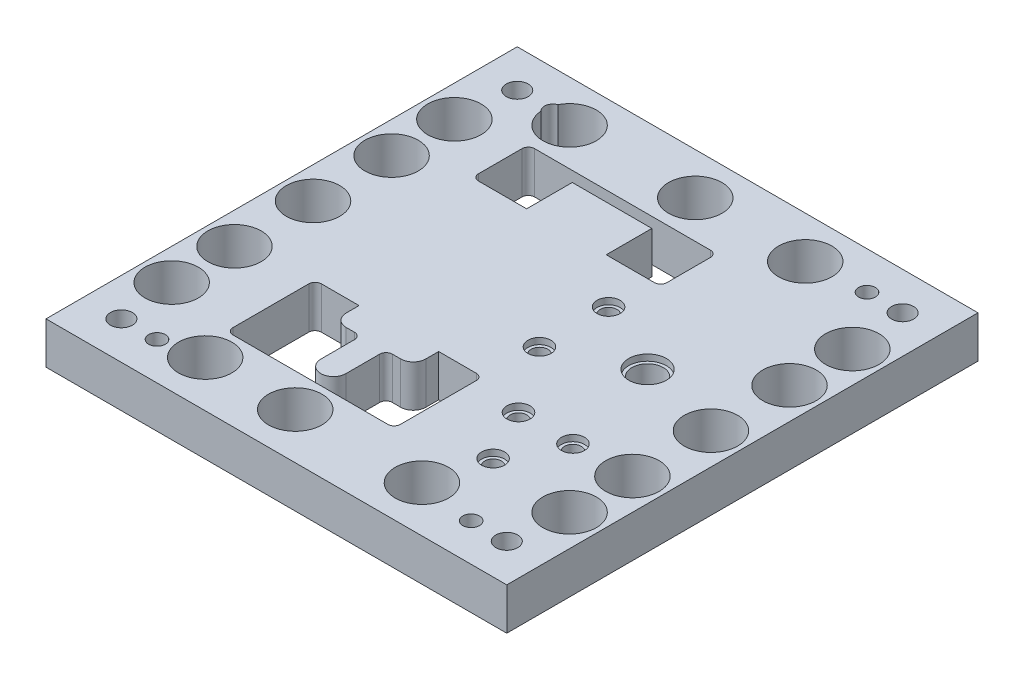
from build123d import *

# Parameters (mm, degrees)
SKETCH1_W                                    = 220
SKETCH1_H                                    = 225
BOSS_EXTRUDE1_DEPTH                          = 20
CUT_EXTRUDE3_REACH                           = 160.607
CUT_EXTRUDE4_REACH                           = 160.607
CUT_EXTRUDE5_REACH                           = 160.607
SKETCH7_R                                    = 4
CUT_EXTRUDE6_REACH                           = 160.607
SKETCH9_R                                    = 7.5
SKETCH10_R                                   = 5.5
CUT_EXTRUDE7_DEPTH                           = 3
SKETCH11_R                                   = 9
CUT_EXTRUDE8_DEPTH                           = 3
CBORE_FOR_M10_HEX_SOCKET_HEAD_CAP_SC_2_COUNT = 2
CBORE_FOR_M10_HEX_SOCKET_HEAD_CAP_SC_2_PITCH = 184
CBORE_FOR_M10_HEX_SOCKET_HEAD_CAP_SC_3_COUNT = 2
CBORE_FOR_M10_HEX_SOCKET_HEAD_CAP_SC_3_PITCH = 263.774524926
CBORE_FOR_M10_HEX_SOCKET_HEAD_CAP_SC_4_COUNT = 2
CBORE_FOR_M10_HEX_SOCKET_HEAD_CAP_SC_4_PITCH = 189
F_8_0MM_DOWEL_HOLE1_D                        = 8
F_25_5_25_5_DIAMETER_HOLE1_D                 = 25.5


with BuildPart() as part:
    # Sketch1 → Boss-Extrude1 (new body)
    with BuildSketch(Plane(origin=(0, 0, 0), x_dir=(1, 0, 0), z_dir=(0, 1, 0))):
        Rectangle(SKETCH1_W, SKETCH1_H)
    extrude(amount=-BOSS_EXTRUDE1_DEPTH)

    # Sketch5 → Cut-Extrude3 (cut, up to next)
    with BuildSketch(Plane(origin=(0, 0, 0), x_dir=(1, 0, 0), z_dir=(0, 1, 0)), mode=Mode.PRIVATE) as cut_extrude3_sk1:
        with BuildLine():
            Line((-2.75, -38.4), (-2.75, -32.27))
            Line((-2.75, -32.27), (15.25, -32.27))
            ThreePointArc((15.25, -32.27), (17.371320344, -33.148679656), (18.25, -35.27))
            Line((18.25, -35.27), (18.25, -71.53))
            ThreePointArc((18.25, -71.53), (17.371320344, -73.651320344), (15.25, -74.53))
            Line((15.25, -74.53), (-58.75, -74.53))
            ThreePointArc((-58.75, -74.53), (-60.871320344, -73.651320344), (-61.75, -71.53))
            Line((-61.75, -71.53), (-61.75, -35.27))
            ThreePointArc((-61.75, -35.27), (-60.871320344, -33.148679656), (-58.75, -32.27))
            Line((-58.75, -32.27), (-40.75, -32.27))
            Line((-40.75, -32.27), (-40.75, -38.4))
            ThreePointArc((-40.75, -38.4), (-38.992640687, -42.642640687), (-34.75, -44.4))
            Line((-34.75, -44.4), (-30.75, -44.4))
            ThreePointArc((-30.75, -44.4), (-28.628679656, -45.278679656), (-27.75, -47.4))
            Line((-27.75, -47.4), (-27.75, -63.53))
            ThreePointArc((-27.75, -63.53), (-21.75, -69.53), (-15.75, -63.53))
            Line((-15.75, -63.53), (-15.75, -47.4))
            ThreePointArc((-15.75, -47.4), (-14.871320344, -45.278679656), (-12.75, -44.4))
            Line((-12.75, -44.4), (-8.75, -44.4))
            ThreePointArc((-8.75, -44.4), (-4.507359313, -42.642640687), (-2.75, -38.4))
        make_face()
    cut_extrude3_tool1 = extrude(cut_extrude3_sk1.sketch, amount=-CUT_EXTRUDE3_REACH, mode=Mode.PRIVATE) & part.part
    add(cut_extrude3_tool1.solids().sort_by_distance((-1.84524, 0, 35.335))[0], mode=Mode.SUBTRACT)

    # Sketch6 → Cut-Extrude4 (cut, up to next)
    with BuildSketch(Plane(origin=(0, 0, 0), x_dir=(1, 0, 0), z_dir=(0, 1, 0)), mode=Mode.PRIVATE) as cut_extrude4_sk1:
        with BuildLine():
            Line((-40.75, 47.73), (-63.75, 47.73))
            ThreePointArc((-63.75, 47.73), (-65.871320344, 48.608679656), (-66.75, 50.73))
            Line((-66.75, 50.73), (-66.75, 71.53))
            ThreePointArc((-66.75, 71.53), (-65.871320344, 73.651320344), (-63.75, 74.53))
            Line((-63.75, 74.53), (20.25, 74.53))
            ThreePointArc((20.25, 74.53), (22.371320344, 73.651320344), (23.25, 71.53))
            Line((23.25, 71.53), (23.25, 50.73))
            ThreePointArc((23.25, 50.73), (22.371320344, 48.608679656), (20.25, 47.73))
            Line((20.25, 47.73), (-2.75, 47.73))
            Line((-2.75, 47.73), (-2.75, 69.53))
            Line((-2.75, 69.53), (-40.75, 69.53))
            Line((-40.75, 69.53), (-40.75, 47.73))
        make_face()
    cut_extrude4_tool1 = extrude(cut_extrude4_sk1.sketch, amount=-CUT_EXTRUDE4_REACH, mode=Mode.PRIVATE) & part.part
    add(cut_extrude4_tool1.solids().sort_by_distance((-52.25, 0, -48.669055))[0], mode=Mode.SUBTRACT)

    # Sketch7 → Cut-Extrude5 (cut, up to next)
    with BuildSketch(Plane(origin=(0, 0, 0), x_dir=(1, 0, 0), z_dir=(0, 1, 0)), mode=Mode.PRIVATE) as cut_extrude5_sk1:
        with Locations((54.5, -63.53)):
            Circle(SKETCH7_R)
    cut_extrude5_tool1 = extrude(cut_extrude5_sk1.sketch, amount=-CUT_EXTRUDE5_REACH, mode=Mode.PRIVATE) & part.part
    # Sketch7 → Cut-Extrude5 (cut, up to next)
    with BuildSketch(Plane(origin=(0, 0, 0), x_dir=(1, 0, 0), z_dir=(0, 1, 0)), mode=Mode.PRIVATE) as cut_extrude5_sk2:
        with Locations((67.5, -38.4)):
            Circle(SKETCH7_R)
    cut_extrude5_tool2 = extrude(cut_extrude5_sk2.sketch, amount=-CUT_EXTRUDE5_REACH, mode=Mode.PRIVATE) & part.part
    # Sketch7 → Cut-Extrude5 (cut, up to next)
    with BuildSketch(Plane(origin=(0, 0, 0), x_dir=(1, 0, 0), z_dir=(0, 1, 0)), mode=Mode.PRIVATE) as cut_extrude5_sk3:
        with Locations((41.5, -38.4)):
            Circle(SKETCH7_R)
    cut_extrude5_tool3 = extrude(cut_extrude5_sk3.sketch, amount=-CUT_EXTRUDE5_REACH, mode=Mode.PRIVATE) & part.part
    # Sketch7 → Cut-Extrude5 (cut, up to next)
    with BuildSketch(Plane(origin=(0, 0, 0), x_dir=(1, 0, 0), z_dir=(0, 1, 0)), mode=Mode.PRIVATE) as cut_extrude5_sk4:
        with Locations((19.38, -6.27)):
            Circle(SKETCH7_R)
    cut_extrude5_tool4 = extrude(cut_extrude5_sk4.sketch, amount=-CUT_EXTRUDE5_REACH, mode=Mode.PRIVATE) & part.part
    # Sketch7 → Cut-Extrude5 (cut, up to next)
    with BuildSketch(Plane(origin=(0, 0, 0), x_dir=(1, 0, 0), z_dir=(0, 1, 0)), mode=Mode.PRIVATE) as cut_extrude5_sk5:
        with Locations((19.38, 26.73)):
            Circle(SKETCH7_R)
    cut_extrude5_tool5 = extrude(cut_extrude5_sk5.sketch, amount=-CUT_EXTRUDE5_REACH, mode=Mode.PRIVATE) & part.part
    add(cut_extrude5_tool1.solids().sort_by_distance((54.5, 0, 63.53))[0], mode=Mode.SUBTRACT)
    add(cut_extrude5_tool2.solids().sort_by_distance((67.5, 0, 38.4))[0], mode=Mode.SUBTRACT)
    add(cut_extrude5_tool3.solids().sort_by_distance((41.5, 0, 38.4))[0], mode=Mode.SUBTRACT)
    add(cut_extrude5_tool4.solids().sort_by_distance((19.38, 0, 6.27))[0], mode=Mode.SUBTRACT)
    add(cut_extrude5_tool5.solids().sort_by_distance((19.38, 0, -26.73))[0], mode=Mode.SUBTRACT)

    # Sketch9 → Cut-Extrude6 (cut, up to next)
    with BuildSketch(Plane(origin=(0, 0, 0), x_dir=(1, 0, 0), z_dir=(0, 1, 0)), mode=Mode.PRIVATE) as cut_extrude6_sk1:
        with Locations((54.5, 10.23)):
            Circle(SKETCH9_R)
    cut_extrude6_tool1 = extrude(cut_extrude6_sk1.sketch, amount=-CUT_EXTRUDE6_REACH, mode=Mode.PRIVATE) & part.part
    add(cut_extrude6_tool1.solids().sort_by_distance((54.5, 0, -10.23))[0], mode=Mode.SUBTRACT)

    # Sketch10 → Cut-Extrude7 (cut)
    with BuildSketch(Plane(origin=(0, 0, 0), x_dir=(1, 0, 0), z_dir=(0, 1, 0))):
        with Locations((19.38, 26.73)):
            Circle(SKETCH10_R)
        with Locations((19.38, -6.27)):
            Circle(SKETCH10_R)
        with Locations((41.5, -38.4)):
            Circle(SKETCH10_R)
        with Locations((67.5, -38.4)):
            Circle(SKETCH10_R)
        with Locations((54.5, -63.53)):
            Circle(SKETCH10_R)
    extrude(amount=-CUT_EXTRUDE7_DEPTH, mode=Mode.SUBTRACT)

    # Sketch11 → Cut-Extrude8 (cut)
    with BuildSketch(Plane(origin=(0, 0, 0), x_dir=(1, 0, 0), z_dir=(0, 1, 0))):
        with Locations((54.5, 10.23)):
            Circle(SKETCH11_R)
    extrude(amount=-CUT_EXTRUDE8_DEPTH, mode=Mode.SUBTRACT)

    # Sketch16 → CBORE for M10 Hex Socket Head Cap Screw1 (revolve, cut)
    with BuildSketch(Plane(origin=(92, -20, -94.5), x_dir=(0, 0, -1), z_dir=(1, 0, 0))):
        Polygon((0, 0), (0, 20), (5.25, 20), (5.25, 10.6), (9, 10.6), (9, 0.025), (9.025, 0), align=None)
    cbore_for_m10_hex_socket_head_cap_screw1 = revolve(axis=Axis((92, -26.35, -94.5), (0, 1, 0)), mode=Mode.SUBTRACT)

    # CBORE for M10 Hex Socket Head Cap Sc 2: CBORE for M10 Hex Socket Head Cap Screw1 ×2
    with Locations(*[(-i * CBORE_FOR_M10_HEX_SOCKET_HEAD_CAP_SC_2_PITCH, 0, 0) for i in range(1, CBORE_FOR_M10_HEX_SOCKET_HEAD_CAP_SC_2_COUNT)]):
        add(cbore_for_m10_hex_socket_head_cap_screw1, mode=Mode.SUBTRACT)

    # CBORE for M10 Hex Socket Head Cap Sc 3: CBORE for M10 Hex Socket Head Cap Screw1 ×2
    with Locations(*[Vector(-0.6975654682783963, 0, 0.7165210516555266) * (i * CBORE_FOR_M10_HEX_SOCKET_HEAD_CAP_SC_3_PITCH) for i in range(1, CBORE_FOR_M10_HEX_SOCKET_HEAD_CAP_SC_3_COUNT)]):
        add(cbore_for_m10_hex_socket_head_cap_screw1, mode=Mode.SUBTRACT)

    # CBORE for M10 Hex Socket Head Cap Sc 4: CBORE for M10 Hex Socket Head Cap Screw1 ×2
    with Locations(*[(0, 0, i * CBORE_FOR_M10_HEX_SOCKET_HEAD_CAP_SC_4_PITCH) for i in range(1, CBORE_FOR_M10_HEX_SOCKET_HEAD_CAP_SC_4_COUNT)]):
        add(cbore_for_m10_hex_socket_head_cap_screw1, mode=Mode.SUBTRACT)

    # Ø8.0mm Dowel Hole1 (through all)
    with Locations(Plane(origin=(0, -20, 0), x_dir=(-1, 0, 0), z_dir=(0, -1, 0))):
        with Locations((-75, 94.5), (75, 94.5), (75, -94.5), (-75, -94.5)):
            Hole(F_8_0MM_DOWEL_HOLE1_D / 2)

    # Ø25.5 (25.5) Diameter Hole1 (through all)
    with Locations(Plane(origin=(0, 0, 0), x_dir=(1, 0, 0), z_dir=(0, 1, 0))):
        with Locations((-65, 92.5), (-5, 92.5), (47.5, 92.5), (95, 67.5), (95, 37.5), (95, 0), (95, -37.5), (95, -67.5), (47.5, -90.5), (-13, -90.5), (-56, -90.5), (-95, -67.5), (-95, -37.5), (-95, 0), (-95, 67.5), (-95, 37.5)):
            Hole(F_25_5_25_5_DIAMETER_HOLE1_D / 2)


solid = part.part
